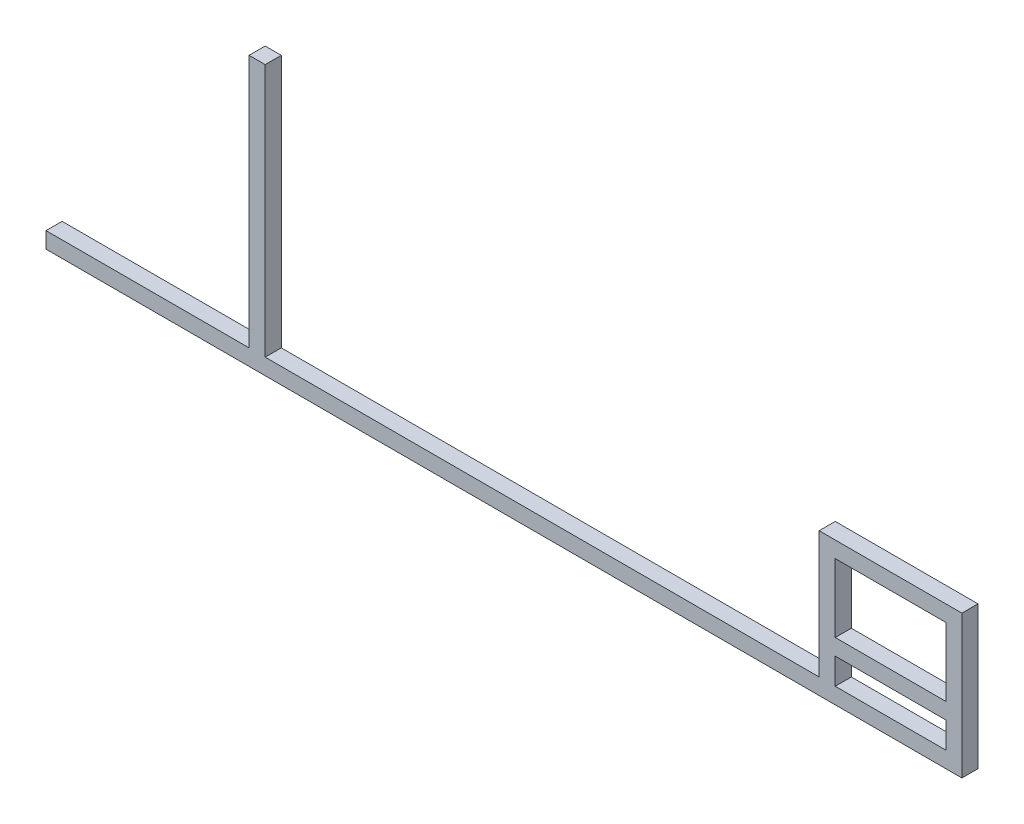
from build123d import *

# Parameters (mm, degrees)
SKETCH1_W            = 261.9
SKETCH1_H            = 61.9
SKETCH1_H_2          = 161.9
BOSS_EXTRUDE1_DEPTH  = 38.1
SHELL1_START         = 3.175
SHELL1_OUTLINE_W     = 31.75
SHELL1_OUTLINE_H     = 31.75
SHELL1_DEPTH         = 2162.7
SHELL1_START_2       = 1834.125
SHELL1_2_OUTLINE_W   = 31.75
SHELL1_2_OUTLINE_H   = 31.75
SHELL1_2_DEPTH       = 331.75
SHELL1_START_3       = 484.125
SHELL1_3_OUTLINE_W   = 600
SHELL1_3_OUTLINE_H   = 31.75
SHELL1_3_DEPTH       = 31.75
SHELL1_4_OUTLINE_W   = 68.25
SHELL1_4_OUTLINE_H   = 31.75
SHELL1_4_OUTLINE_W_2 = 168.25
SHELL1_4_DEPTH       = 31.75
SHELL1_START_4       = 2134.125
SHELL1_5_OUTLINE_W   = 68.25
SHELL1_5_OUTLINE_H   = 31.75
SHELL1_5_OUTLINE_W_2 = 168.25
SHELL1_5_DEPTH       = 31.75


# Read off the part's stored shape, not the designer's step: Shell1
with BuildPart() as part:
    # Sketch1 → Boss-Extrude1 (new body)
    with BuildSketch(Plane.XY):
        Polygon((0, 0), (2169.05, 0), (2169.05, 38.1), (2169.05, 138.1), (2169.05, 338.1), (1869.05, 338.1), (1830.95, 338.1), (1830.95, 38.1), (519.05, 38.1), (519.05, 638.1), (480.95, 638.1), (480.95, 38.1), (0, 38.1), align=None)
        with Locations((2000, 69.05)):
            Rectangle(SKETCH1_W, SKETCH1_H, mode=Mode.SUBTRACT)
        with Locations((2000, 219.05)):
            Rectangle(SKETCH1_W, SKETCH1_H_2, mode=Mode.SUBTRACT)
    extrude(amount=-BOSS_EXTRUDE1_DEPTH)

    # Shell1 outline → Shell1 (cut)
    with BuildSketch(Plane.YZ.offset(SHELL1_START)):
        with Locations((19.05, -19.05)):
            Rectangle(SHELL1_OUTLINE_W, SHELL1_OUTLINE_H)
    extrude(amount=SHELL1_DEPTH, mode=Mode.SUBTRACT)

    # Shell1 2 outline → Shell1 2 (cut)
    with BuildSketch(Plane.YZ.offset(SHELL1_START_2)):
        with Locations((119.05, -19.05)):
            Rectangle(SHELL1_2_OUTLINE_W, SHELL1_2_OUTLINE_H)
        with Locations((319.05, -19.05)):
            Rectangle(SHELL1_2_OUTLINE_W, SHELL1_2_OUTLINE_H)
    extrude(amount=SHELL1_2_DEPTH, mode=Mode.SUBTRACT)

    # Shell1 3 outline → Shell1 3 (cut)
    with BuildSketch(Plane.YZ.offset(SHELL1_START_3)):
        with Locations((334.925, -19.05)):
            Rectangle(SHELL1_3_OUTLINE_W, SHELL1_3_OUTLINE_H)
    extrude(amount=SHELL1_3_DEPTH, mode=Mode.SUBTRACT)

    # Shell1 4 outline → Shell1 4 (cut)
    with BuildSketch(Plane.YZ.offset(SHELL1_START_2)):
        with Locations((69.05, -19.05)):
            Rectangle(SHELL1_4_OUTLINE_W, SHELL1_4_OUTLINE_H)
        with Locations((219.05, -19.05)):
            Rectangle(SHELL1_4_OUTLINE_W_2, SHELL1_4_OUTLINE_H)
    extrude(amount=SHELL1_4_DEPTH, mode=Mode.SUBTRACT)

    # Shell1 5 outline → Shell1 5 (cut)
    with BuildSketch(Plane.YZ.offset(SHELL1_START_4)):
        with Locations((69.05, -19.05)):
            Rectangle(SHELL1_5_OUTLINE_W, SHELL1_5_OUTLINE_H)
        with Locations((219.05, -19.05)):
            Rectangle(SHELL1_5_OUTLINE_W_2, SHELL1_5_OUTLINE_H)
    extrude(amount=SHELL1_5_DEPTH, mode=Mode.SUBTRACT)


solid = part.part
